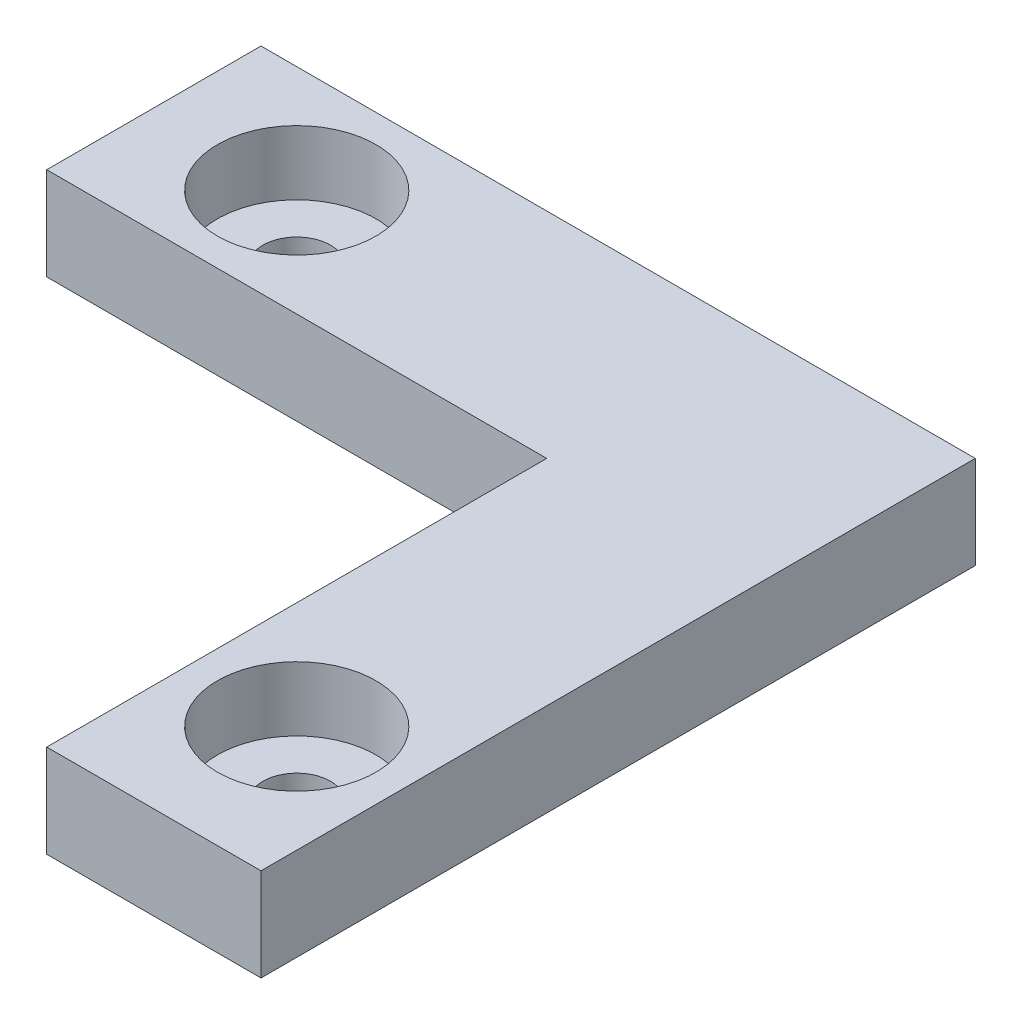
from build123d import *

# Parameters (mm, degrees)
BOSS_EXTRUDE1_DEPTH = 8.255
SKETCH1_3_R         = 7.05
SKETCH1_3_R_2       = 3
BOSS_EXTRUDE2_DEPTH = 2.54


with BuildPart() as part:
    # Sketch1 → Boss-Extrude1 (new body)
    with BuildSketch(Plane(origin=(0, 0, 0), x_dir=(1, 0, 0), z_dir=(0, 1, 0))):
        Polygon((0, 19.05), (0, 9.525), (0, 0), (44.45, 0), (44.45, -44.45), (53.975, -44.45), (63.5, -44.45), (63.5, 0), (63.5, 19.05), align=None)
        with BuildLine():
            ThreePointArc((61.025, -31.75), (58.960102807, -36.735102807), (53.975, -38.8))
            ThreePointArc((53.975, -38.8), (48.989897193, -26.764897193), (61.025, -31.75))
        make_face(mode=Mode.SUBTRACT)
        with BuildLine():
            ThreePointArc((19.75, 9.525), (12.7, 2.475), (5.65, 9.525))
            ThreePointArc((5.65, 9.525), (12.7, 16.575), (19.75, 9.525))
        make_face(mode=Mode.SUBTRACT)
    extrude(amount=BOSS_EXTRUDE1_DEPTH)

    # Sketch1<3> → Boss-Extrude2 (add)
    # profile 1 of 2: a face of its own
    with BuildSketch(Plane(origin=(0, 0, 0), x_dir=(1, 0, 0), z_dir=(0, 1, 0))):
        with Locations((12.7, 9.525)):
            Circle(SKETCH1_3_R)
        with Locations((12.7, 9.525)):
            Circle(SKETCH1_3_R_2, mode=Mode.SUBTRACT)
    # profile 2 of 2: a face of its own
    with BuildSketch(Plane(origin=(0, 0, 0), x_dir=(1, 0, 0), z_dir=(0, 1, 0))):
        with Locations((53.975, -31.75)):
            Circle(SKETCH1_3_R)
        with Locations((53.975, -31.75)):
            Circle(SKETCH1_3_R_2, mode=Mode.SUBTRACT)
    extrude(amount=BOSS_EXTRUDE2_DEPTH)


solid = part.part
